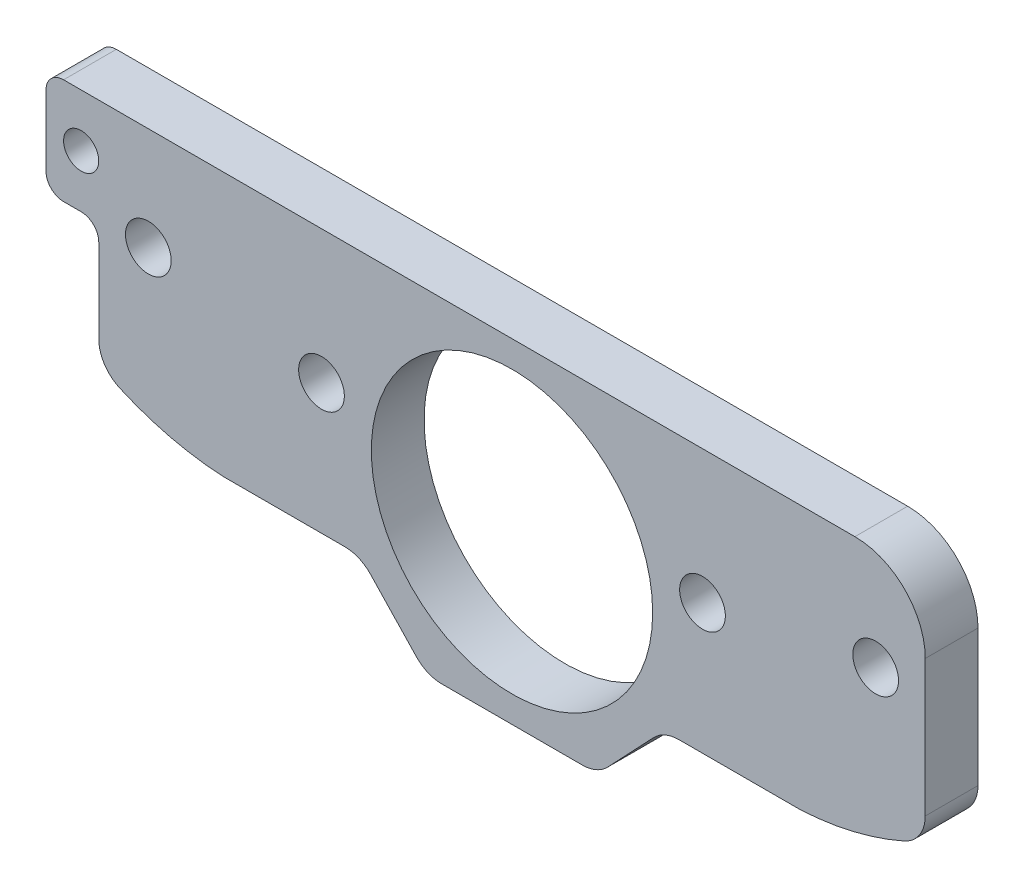
from build123d import *

# Parameters (mm, degrees)
SKETCH_1_R      = 8
SKETCH_1_R_2    = 1.3
SKETCH_1_R_3    = 1
EXTRUDE_1_DEPTH = 3


with BuildPart() as part:
    # Эскиз1 → Бобышка-Вытянуть1 (new body)
    with BuildSketch(Plane.XY):
        with BuildLine():
            Line((-6.518358777, -10.340325606), (1.465690046, -10.340325606))
            ThreePointArc((1.465690046, -10.340325606), (2.256306564, -10.177422642), (2.918129308, -9.715251127))
            Line((2.918129308, -9.715251127), (5.521226372, -6.965400084))
            ThreePointArc((5.521226372, -6.965400084), (6.183049116, -6.503228569), (6.973665634, -6.340325606))
            Line((6.973665634, -6.340325606), (13.892631628, -6.340325606))
            ThreePointArc((13.892631628, -6.340325606), (16.904299295, -5.903285188), (19.786277649, -4.925866529))
            ThreePointArc((19.786277649, -4.925866529), (20.650750013, -4.188065733), (20.973665634, -3.098392394))
            Line((20.973665634, -3.098392394), (20.973665634, 4.659674394))
            ThreePointArc((20.973665634, 4.659674394), (19.802092759, 7.488101519), (16.973665634, 8.659674394))
            Line((16.973665634, 8.659674394), (-22.026334366, 8.659674394))
            Line((-22.026334366, 8.659674394), (-28.026334366, 8.659674394))
            ThreePointArc((-28.026334366, 8.659674394), (-28.733441147, 8.366781175), (-29.026334366, 7.659674394))
            Line((-29.026334366, 7.659674394), (-29.026334366, 3.659674394))
            ThreePointArc((-29.026334366, 3.659674394), (-28.733441147, 2.952567613), (-28.026334366, 2.659674394))
            Line((-28.026334366, 2.659674394), (-27.026334366, 2.659674394))
            ThreePointArc((-27.026334366, 2.659674394), (-26.319227584, 2.366781175), (-26.026334366, 1.659674394))
            Line((-26.026334366, 1.659674394), (-26.026334366, -3.098392394))
            ThreePointArc((-26.026334366, -3.098392394), (-25.703418745, -4.188065733), (-24.83894638, -4.925866529))
            ThreePointArc((-24.83894638, -4.925866529), (-21.956968026, -5.903285188), (-18.945300359, -6.340325606))
            Line((-18.945300359, -6.340325606), (-12.026334366, -6.340325606))
            ThreePointArc((-12.026334366, -6.340325606), (-11.235717848, -6.503228569), (-10.573895103, -6.965400084))
            Line((-10.573895103, -6.965400084), (-7.970798039, -9.715251127))
            ThreePointArc((-7.970798039, -9.715251127), (-7.308975295, -10.177422642), (-6.518358777, -10.340325606))
        make_face()
        with Locations((-2.526334366, -0.840325606)):
            Circle(SKETCH_1_R, mode=Mode.SUBTRACT)
        with Locations((-23.207297179, 2.806286125)):
            Circle(SKETCH_1_R_2, mode=Mode.SUBTRACT)
        with Locations((-13.359219649, 1.069804348)):
            Circle(SKETCH_1_R_2, mode=Mode.SUBTRACT)
        with Locations((8.306550917, 1.069804348)):
            Circle(SKETCH_1_R_2, mode=Mode.SUBTRACT)
        with Locations((18.154628448, 2.806286125)):
            Circle(SKETCH_1_R_2, mode=Mode.SUBTRACT)
        with Locations((-27.026334366, 5.659674394)):
            Circle(SKETCH_1_R_3, mode=Mode.SUBTRACT)
    extrude(amount=EXTRUDE_1_DEPTH)


solid = part.part
